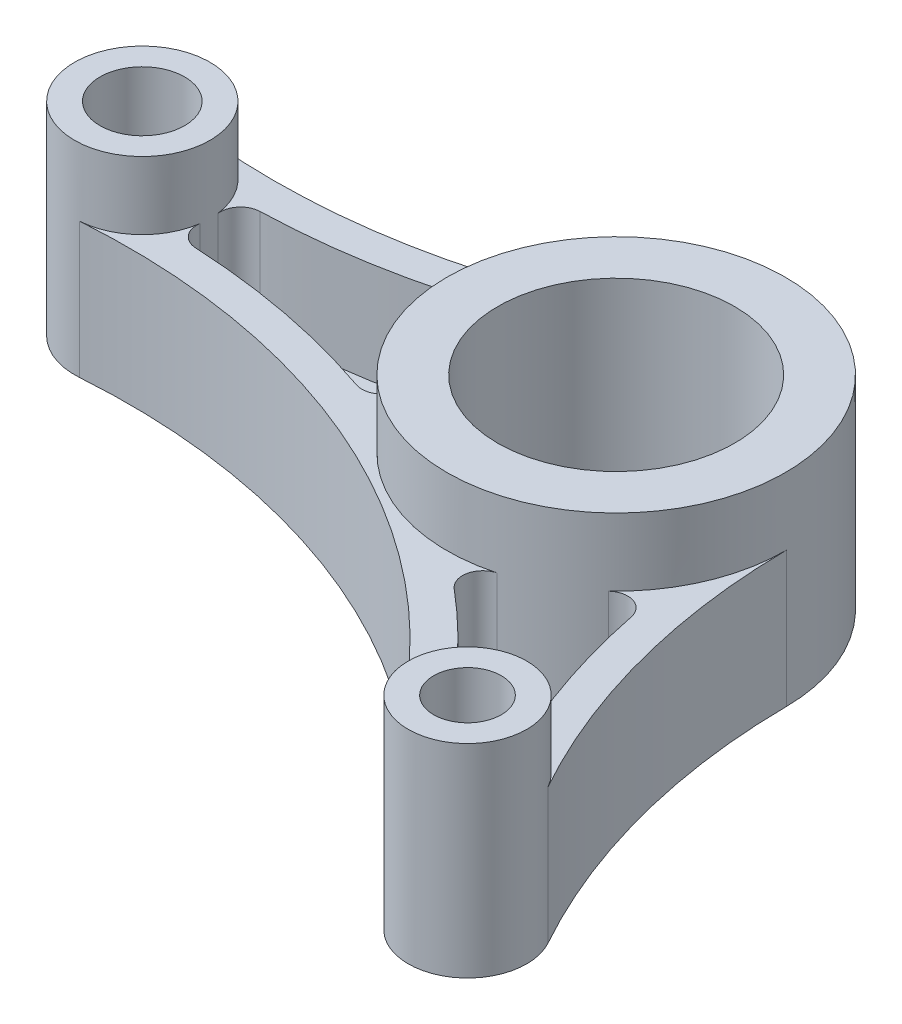
from build123d import *

# Parameters (mm, degrees)
SKETCH8_R             = 6.35
BOSS_EXTRUDE7_DEPTH   = 19.05
SKETCH8_R_2           = 15.875
BOSS_EXTRUDE7_2_DEPTH = 19.05
SKETCH8_R_3           = 5.55625
BOSS_EXTRUDE7_3_DEPTH = 19.05
BOSS_EXTRUDE8_DEPTH   = 12.7
SKETCH9_R             = 3.175
SKETCH9_R_2           = 12.7
SKETCH9_R_3           = 2.38125
CUT_EXTRUDE3_DEPTH    = 67.556631241
SHELL3_START          = 3.175
SHELL3_DEPTH          = 9.525
SKETCH11_R            = 15.875
BOSS_EXTRUDE9_DEPTH   = 19.05
SKETCH12_R            = 3.96875
SKETCH12_R_2          = 11.1125
SKETCH12_R_3          = 3.175
CUT_EXTRUDE4_DEPTH    = 67.556631241
FILLET1_R             = 1.905


# Read off the part's stored shape, not the designer's step: Shell3
with BuildPart() as part:
    # Sketch8 → Boss-Extrude7 (new body)
    with BuildSketch(Plane(origin=(0, 0, 0), x_dir=(1, 0, 0), z_dir=(0, 1, 0))):
        with Locations(Location((-44.45, 0, 0), (0, 0, 90))):
            Circle(SKETCH8_R)
    extrude(amount=BOSS_EXTRUDE7_DEPTH)



with BuildPart() as body_2:
    # Sketch8 → Boss-Extrude7 2 (new body)
    with BuildSketch(Plane(origin=(0, 0, 0), x_dir=(1, 0, 0), z_dir=(0, 1, 0))):
        with Locations(Location((0, 0, 0), (0, 0, 90))):
            Circle(SKETCH8_R_2)
    extrude(amount=BOSS_EXTRUDE7_2_DEPTH)


with BuildPart() as body_3:
    # Sketch8 → Boss-Extrude7 3 (new body)
    with BuildSketch(Plane(origin=(0, 0, 0), x_dir=(1, 0, 0), z_dir=(0, 1, 0))):
        with Locations(Location((19.05, -32.995567884, 0), (0, 0, 90))):
            Circle(SKETCH8_R_3)
    extrude(amount=BOSS_EXTRUDE7_3_DEPTH)


with BuildPart() as part_1:
    add(part.part)

    add(body_2.part)  # Boss-Extrude8 merges body 2

    add(body_3.part)  # Boss-Extrude8 merges body 3
    # Sketch1 → Boss-Extrude8 (add)
    with BuildSketch(Plane(origin=(0, 0, 0), x_dir=(1, 0, 0), z_dir=(0, 1, 0))):
        with BuildLine():
            ThreePointArc((15.874516986, 0.123836405), (15.874879246, 0.061918673), (15.875, 0))
            ThreePointArc((15.875, 0), (-8.083566746, -13.662780598), (-7.642678571, 13.914204586))
            ThreePointArc((-7.642678571, 13.914204586), (-25.197394313, 7.419323178), (-43.883035714, 6.324638448))
            ThreePointArc((-43.883035714, 6.324638448), (-39.763704917, 4.284989894), (-38.1, 0))
            ThreePointArc((-38.1, 0), (-39.80230939, -4.326831634), (-43.996526612, -6.333787326))
            ThreePointArc((-43.996526612, -6.333787326), (-10.719971263, -13.048717363), (14.342154608, -35.946517871))
            ThreePointArc((14.342154608, -35.946517871), (16.221269303, -28.213288437), (23.903541316, -30.290932834))
            ThreePointArc((23.903541316, -30.290932834), (17.975858999, -15.588595272), (15.874516986, 0.123836405))
        make_face()
    extrude(amount=BOSS_EXTRUDE8_DEPTH)

    # Sketch9 → Cut-Extrude3 (cut, through all)
    with BuildSketch(Plane(origin=(0, 19.05, 0), x_dir=(1, 0, 0), z_dir=(0, 1, 0))):
        with Locations(Location((-44.45, 0, 0), (0, 0, 270))):
            Circle(SKETCH9_R)
        with Locations(Location((0, 0, 0), (0, 0, 270))):
            Circle(SKETCH9_R_2)
        with Locations(Location((19.05, -32.995567884, 0), (0, 0, 270))):
            Circle(SKETCH9_R_3)
    extrude(amount=-CUT_EXTRUDE3_DEPTH, mode=Mode.SUBTRACT)

    # Shell3 outline → Shell3 (cut)
    with BuildSketch(Plane(origin=(0, 0, 0), x_dir=(1, 0, 0), z_dir=(0, 1, 0)).offset(SHELL3_START)):
        with BuildLine():
            ThreePointArc((-38.800169089, 2.898604954), (-38.1002552, -0.05692953), (-38.853048837, -2.999439561))
            ThreePointArc((-38.853048837, -2.999439561), (-25.959917491, -4.378054539), (-13.577434664, -8.226110438))
            ThreePointArc((-13.577434664, -8.226110438), (-15.868541202, -0.452796995), (-14.024412997, 7.438512289))
            ThreePointArc((-14.024412997, 7.438512289), (-26.19595995, 3.987969239), (-38.800169089, 2.898604954))
        make_face()
        with BuildLine():
            ThreePointArc((13.339048882, -8.607287606), (7.563042072, -13.957650935), (-0.073256974, -15.874830973))
            ThreePointArc((-0.073256974, -15.874830973), (7.639502671, -22.480309716), (14.259701701, -30.180437999))
            ThreePointArc((14.259701701, -30.180437999), (16.221269303, -28.213288437), (18.889968849, -27.441622971))
            ThreePointArc((18.889968849, -27.441622971), (15.417387842, -18.229913189), (13.339048882, -8.607287606))
        make_face()
    extrude(amount=SHELL3_DEPTH, mode=Mode.SUBTRACT)

    # Sketch11 → Boss-Extrude9 (add)
    with BuildSketch(Plane(origin=(0, 0, 0), x_dir=(1, 0, 0), z_dir=(0, 1, 0))):
        with Locations(Location((0, 0, 0), (0, 0, 118.778745897))):
            Circle(SKETCH11_R)
    extrude(amount=BOSS_EXTRUDE9_DEPTH)

    # Sketch12 → Cut-Extrude4 (cut, through all)
    with BuildSketch(Plane(origin=(0, 19.05, 0), x_dir=(1, 0, 0), z_dir=(0, 1, 0))):
        with Locations(Location((-44.45, 0, 0), (0, 0, 270))):
            Circle(SKETCH12_R)
        with Locations(Location((0, 0, 0), (0, 0, 270))):
            Circle(SKETCH12_R_2)
        with Locations(Location((19.05, -32.995567884, 0), (0, 0, 270))):
            Circle(SKETCH12_R_3)
    extrude(amount=-CUT_EXTRUDE4_DEPTH, mode=Mode.SUBTRACT)

    # Fillet1
    fillet1_edges = [part_1.edges().sort_by_distance(p)[0] for p in [
        (18.889968849, 7.9375, 27.441622971),
        (14.259701701, 7.9375, 30.180437999),
        (-0.073256974, 7.9375, 15.874830973),
        (13.339048882, 7.9375, 8.607287606),
        (-14.024412997, 7.9375, -7.438512289),
        (-13.577434664, 7.9375, 8.226110438),
        (-38.800169089, 7.9375, -2.898604954),
        (-38.853048837, 7.9375, 2.999439561),
    ]]
    fillet(fillet1_edges, radius=FILLET1_R)


solid = part_1.part
